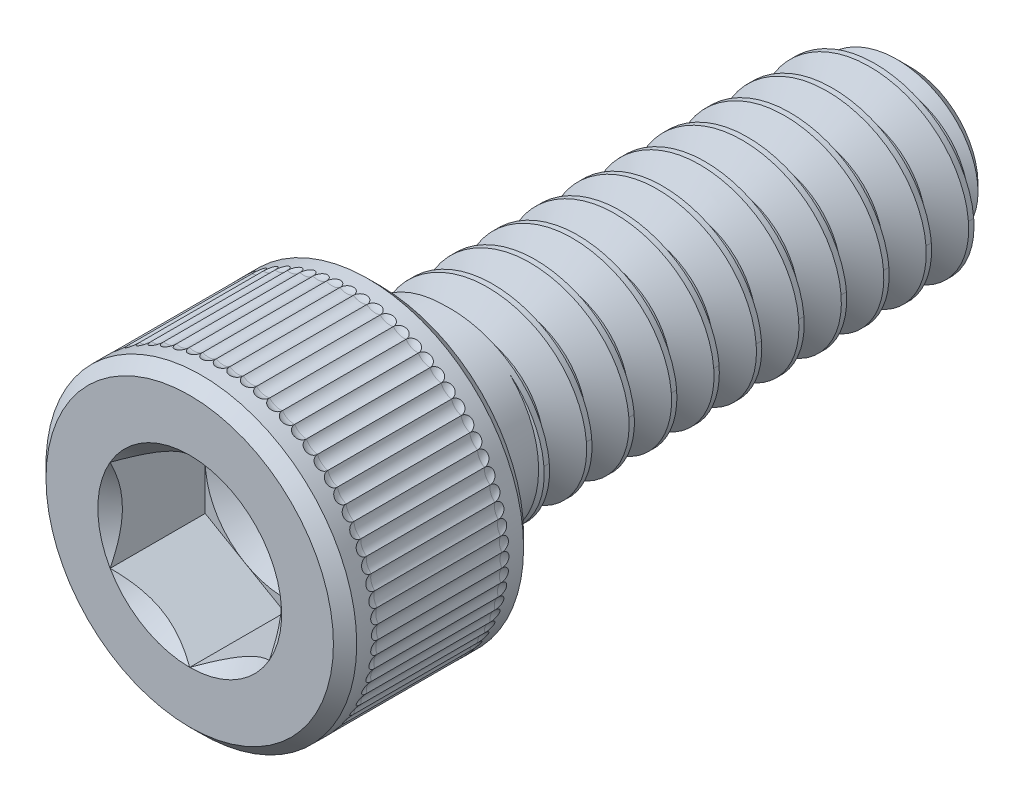
from build123d import *
from build123d.topology import SkipClean

# Parameters (mm, degrees)
CUT_EXTRUDE1_DEPTH     = 1.4224
CUT_SWEEP1_PITCH       = 0.635
CUT_SWEEP1_HEIGHT      = 8.334375
CUT_SWEEP1_RADIUS      = 1.4224
CUT_SWEEP1_START_ANGLE = 90
CIRPATTERN1_COUNT      = 72


with BuildPart() as part:
    # Sketch2 → Revolve1 (revolve)
    with BuildSketch(Plane(origin=(0, 0, 0), x_dir=(0, 0, -1), z_dir=(1, 0, 0)), mode=Mode.PRIVATE) as revolve1_sk:
        with BuildLine():
            Line((-2.7206575, 2.3241), (-2.54635, 2.1497925))
            Line((-2.54635, 2.1497925), (-2.54635, 1.56464))
            ThreePointArc((-2.54635, 1.56464), (-2.504688869, 1.464061131), (-2.40411, 1.4224))
            Line((-2.40411, 1.4224), (4.978705401, 1.4224))
            Line((4.978705401, 1.4224), (5.39115, 1.009955401))
            Line((5.39115, 1.009955401), (5.39115, 0))
            Line((5.39115, 0), (-3.96875, 0))
            Line((-3.96875, 0), (-3.96875, 1.190625))
            Line((-3.96875, 1.190625), (-5.39115, 1.190625))
            Line((-5.39115, 1.190625), (-5.39115, 2.1497925))
            Line((-5.39115, 2.1497925), (-5.2168425, 2.3241))
            Line((-5.2168425, 2.3241), (-2.7206575, 2.3241))
        make_face()
    revolve(revolve1_sk.sketch.rotate(Axis((0, 0, 3.96875), (0, 0, -1)), 90), axis=Axis((0, 0, 3.96875), (0, 0, -1)))

    # Sketch3 → Cut-Extrude1 (cut)
    with BuildSketch(Plane.XY.offset(5.39115)):
        Polygon((0, 1.374815329), (-1.190625, 0.687407664), (-1.190625, -0.687407664), (0, -1.374815329), (1.190625, -0.687407664), (1.190625, 0.687407664), align=None)
    extrude(amount=-CUT_EXTRUDE1_DEPTH, mode=Mode.SUBTRACT)

    # Cut-Extrude2 cone 1 section (through the dimple's axis) → Cut-Extrude2 (revolve, cut)
    with BuildSketch(Plane(origin=(0, 0, 5.39115), x_dir=(0, -1, 0), z_dir=(1, 0, 0))):
        Polygon((0, 0), (1.374815329, 0), (0, 1.374815329), align=None)
    revolve(axis=Axis((0, 0, 5.39115), (0, 0, -1)), mode=Mode.SUBTRACT)

    # Cut-Extrude5 cone 1 section (through the dimple's axis) → Cut-Extrude5 (revolve, cut)
    with BuildSketch(Plane(origin=(0, 0, 3.96875), x_dir=(0, -1, 0), z_dir=(1, 0, 0))):
        Polygon((0, 0), (1.190625, 0), (0, 0.687407664), align=None)
    revolve(axis=Axis((0, 0, 3.96875), (0, 0, -1)), mode=Mode.SUBTRACT)

    # Cut-Sweep1: sweep along a helix
    with BuildLine() as cut_sweep1_path:
        add(Helix(CUT_SWEEP1_PITCH, CUT_SWEEP1_HEIGHT, CUT_SWEEP1_RADIUS, center=(0, 0, -5.39115), direction=(0, 0, 1), mode=Mode.PRIVATE).rotate(Axis((0, 0, -5.39115), (0, 0, 1)), CUT_SWEEP1_START_ANGLE))
    # Sketch8 → Cut-Sweep1 (sweep, cut)
    with BuildSketch(Plane(origin=(0, 0, 0), x_dir=(0, 0, -1), z_dir=(1, 0, 0))):
        Polygon((5.37130625, 1.456770383), (5.96661875, 1.456770383), (5.70865, 1.009955401), (5.629275, 1.009955401), align=None)
    sweep(path=cut_sweep1_path.line, is_frenet=True, mode=Mode.SUBTRACT)

    # Sketch9 → Revolve2 (revolve)
    with SkipClean():  # the faces are left unmerged after this step: merging them gives an invalid solid
        with BuildSketch(Plane(origin=(0, 0, 0), x_dir=(0, 0, -1), z_dir=(1, 0, 0)), mode=Mode.PRIVATE) as revolve2_sk:
            with BuildLine():
                Line((-2.9829125, 0), (-2.9829125, 1.56464))
                Line((-2.9829125, 1.56464), (-2.54635, 1.56464))
                ThreePointArc((-2.54635, 1.56464), (-2.504688869, 1.464061131), (-2.40411, 1.4224))
                Line((-2.40411, 1.4224), (-1.59385, 1.4224))
                Line((-1.59385, 1.4224), (-0.772626977, 0))
                Line((-0.772626977, 0), (-2.9829125, 0))
            make_face()
        revolve(revolve2_sk.sketch.rotate(Axis((0, 0, 0.772626977), (0, 0, 1)), 270), axis=Axis((0, 0, 0.772626977), (0, 0, 1)))
    add(part.part.scale(1), mode=Mode.REPLACE)  # the faces are merged on a copy

    # Sketch12 → Cut-Revolve1 (revolve, cut)
    with BuildSketch(Plane(origin=(0, 0, 0), x_dir=(0, 0, -1), z_dir=(1, 0, 0))):
        with BuildLine():
            Line((-4.89331, 2.294724403), (-3.04419, 2.294724403))
            ThreePointArc((-3.04419, 2.294724403), (-2.900822943, 2.354108983), (-2.841438364, 2.49747604))
            Line((-2.841438364, 2.49747604), (-5.096061636, 2.49747604))
            ThreePointArc((-5.096061636, 2.49747604), (-5.036677057, 2.354108983), (-4.89331, 2.294724403))
        make_face()
    cut_revolve1 = revolve(axis=Axis((0, 2.49747604, 5.096061636), (0, 0, -1)), mode=Mode.SUBTRACT)

    # CirPattern1: Cut-Revolve1 ×72 about axis
    cirpattern1_axis = Axis((0, 0, 0), (0, 0, 1))
    for i in range(1, CIRPATTERN1_COUNT):
        add(cut_revolve1.rotate(cirpattern1_axis, i * 360 / CIRPATTERN1_COUNT), mode=Mode.SUBTRACT)


solid = part.part
